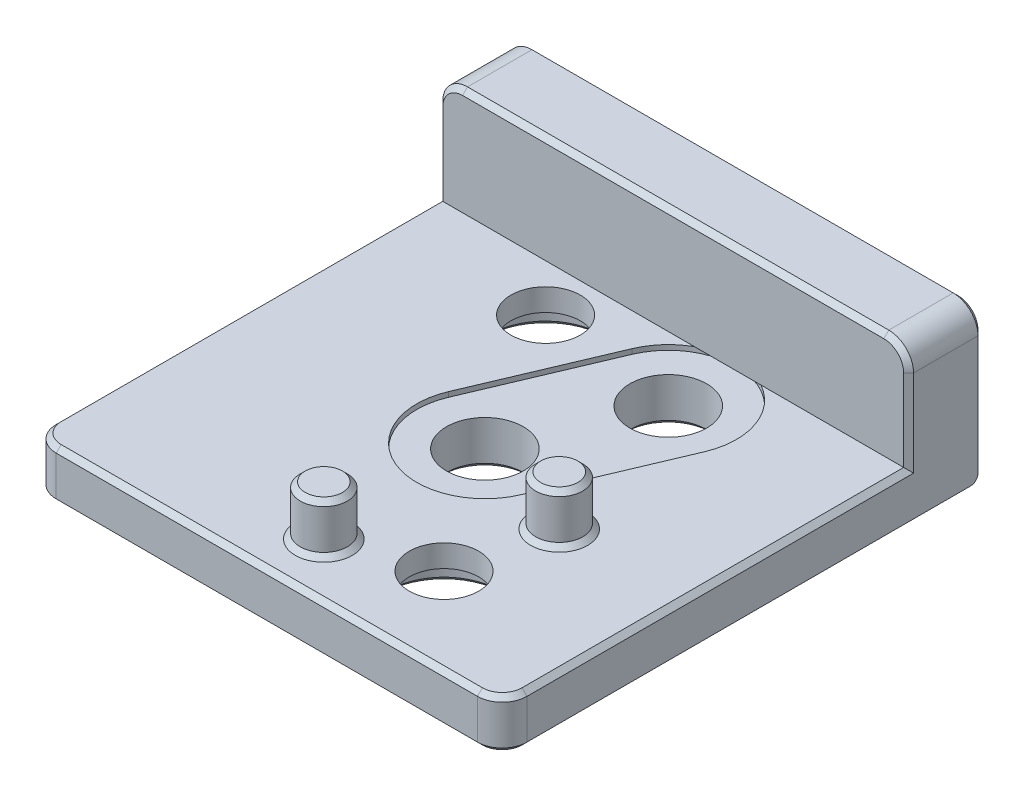
from build123d import *

# Parameters (mm, degrees)
BOSS_EXTRUDE1_DEPTH = 9.5
SKETCH2_R           = 1.55
SKETCH2_R_2         = 1.4
CUT_EXTRUDE1_DEPTH  = 23.024985812
CUT_EXTRUDE2_DEPTH  = 0.2
SKETCH4_R           = 2.25
CUT_EXTRUDE3_DEPTH  = 1.1
FILLET1_R           = 1
SKETCH5_R           = 0.95
BOSS_EXTRUDE2_DEPTH = 2
FILLET4_R           = 0.5
CHAMFER1_SIZE       = 0.2


with BuildPart() as part:
    # Sketch1 → Boss-Extrude1 (new, symmetric)
    with BuildSketch(Plane(origin=(0, 0, 0), x_dir=(0, 0, -1), z_dir=(1, 0, 0))):
        Polygon((16.4, 0), (0, 0), (0, -2), (19.4, -2), (19.4, 4.3), (16.4, 4.3), align=None)
    extrude(amount=BOSS_EXTRUDE1_DEPTH, both=True)

    # Sketch2 → Cut-Extrude1 (cut, through all)
    with BuildSketch(Plane(origin=(0, 0, 0), x_dir=(1, 0, 0), z_dir=(0, 1, 0))):
        with Locations((0, 8.8)):
            Circle(SKETCH2_R)
        with Locations((2.2, 14)):
            Circle(SKETCH2_R)
        with Locations((3.65, 3.5)):
            Circle(SKETCH2_R_2)
        with Locations((-3.25, 14.5)):
            Circle(SKETCH2_R_2)
    extrude(amount=-CUT_EXTRUDE1_DEPTH, mode=Mode.SUBTRACT)

    # Sketch3 → Cut-Extrude2 (cut)
    with BuildSketch(Plane(origin=(0, 0, 0), x_dir=(1, 0, 0), z_dir=(0, 1, 0))):
        with BuildLine():
            Line((-2.53265994, 9.871509975), (-0.33265994, 15.071509975))
            ThreePointArc((-0.33265994, 15.071509975), (3.271509975, 16.53265994), (4.73265994, 12.928490025))
            Line((4.73265994, 12.928490025), (2.53265994, 7.728490025))
            ThreePointArc((2.53265994, 7.728490025), (-1.071509975, 6.26734006), (-2.53265994, 9.871509975))
        make_face()
    extrude(amount=-CUT_EXTRUDE2_DEPTH, mode=Mode.SUBTRACT)

    # Sketch4 → Cut-Extrude3 (cut)
    with BuildSketch(Plane.XZ.offset(2)):
        with Locations((-3.25, -14.5)):
            Circle(SKETCH4_R)
        with Locations((3.65, -3.5)):
            Circle(SKETCH4_R)
    extrude(amount=-CUT_EXTRUDE3_DEPTH, mode=Mode.SUBTRACT)

    # Fillet1
    fillet1_edges = [part.edges().sort_by_distance(p)[0] for p in [
        (-9.5, 4.3, -17.9),
        (9.5, 4.3, -17.9),
        (-9.5, -1, 0),
        (9.5, -1, 0),
    ]]
    fillet(fillet1_edges, radius=FILLET1_R)

    # Sketch5 → Boss-Extrude2 (add)
    with BuildSketch(Plane(origin=(0, 0, 0), x_dir=(1, 0, 0), z_dir=(0, 1, 0))):
        with Locations((0.1, 2.2)):
            Circle(SKETCH5_R)
        with Locations((4.5, 7.3)):
            Circle(SKETCH5_R)
    extrude(amount=BOSS_EXTRUDE2_DEPTH)

    # Fillet4
    fillet4_edges = [part.edges().sort_by_distance(p)[0] for p in [
        (0, -2, -19.4),
    ]]
    fillet(fillet4_edges, radius=FILLET4_R)

    # Chamfer1
    chamfer1_edges = [part.edges().sort_by_distance(p)[0] for p in [
        (9.5, 1.65, -16.4),
        (9.207106781, 4.007106781, -16.4),
        (0, 4.3, -16.4),
        (-9.5, 1.65, -16.4),
        (-9.207106781, 4.007106781, -16.4),
        (9.5, -2, -9.95),
        (9.5, -1.853553391, -19.253553391),
        (9.207106781, -2, -0.292893219),
        (9.5, 0.9, -19.4),
        (0, -2, 0),
        (9.207106781, 4.007106781, -19.4),
        (-9.207106781, -2, -0.292893219),
        (0, 4.3, -19.4),
        (-9.5, -2, -9.95),
        (-9.207106781, 4.007106781, -19.4),
        (-9.5, -1.853553391, -19.253553391),
        (-9.5, 0.9, -19.4),
        (9.5, 0, -8.7),
        (9.207106781, 0, -0.292893219),
        (0, 0, 0),
        (-9.207106781, 0, -0.292893219),
        (-9.5, 0, -8.7),
        (-0.85, 0, -2.2),
        (-0.85, 2, -2.2),
        (3.55, 0, -7.3),
        (3.55, 2, -7.3),
        (-1.55, -2, -8.8),
        (0.65, -2, -14),
        (1.4, -2, -3.5),
        (-5.5, -2, -14.5),
    ]]
    chamfer(chamfer1_edges, length=CHAMFER1_SIZE)


solid = part.part
